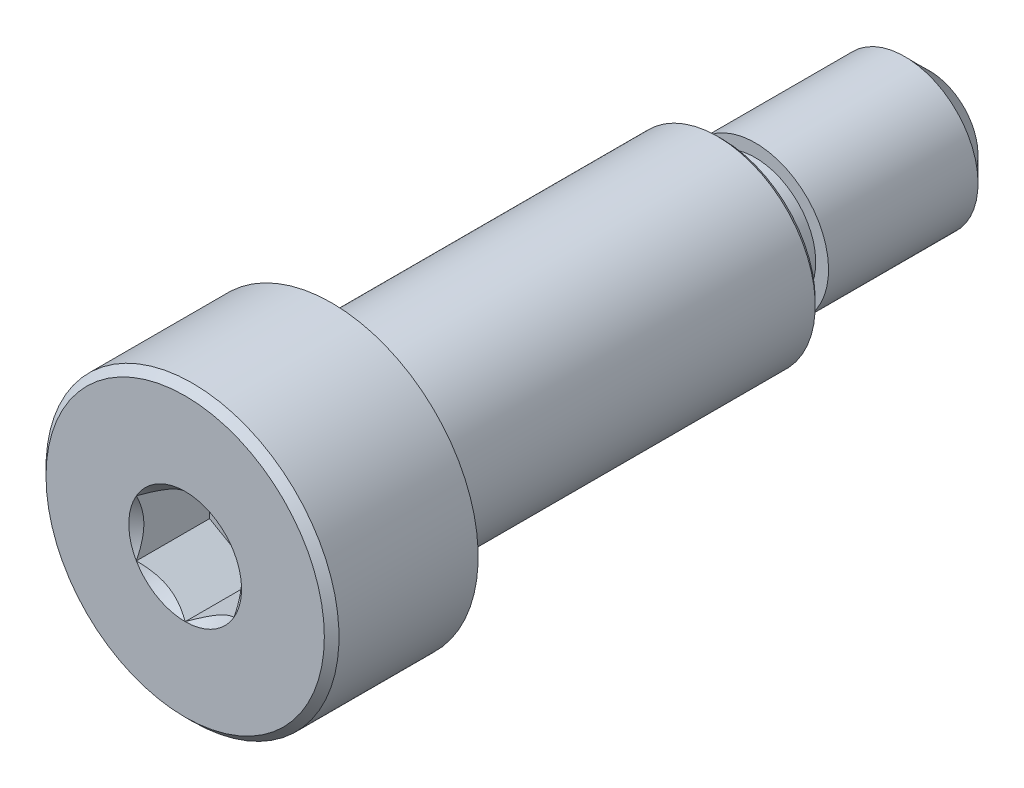
from build123d import *

# Parameters (mm, degrees)
CUT_EXTRUDE1_START = 7.621
CUT_EXTRUDE1_DEPTH = 1.5
CHAMFER1_SIZE      = 0.0975
CHAMFER2_SIZE      = 0.506148016


# Read off the part's stored shape, not the designer's step: Cut-Revolve-Thin1
with BuildPart() as part:
    # Sketch3 → Revolve1 (revolve)
    with BuildSketch(Plane(origin=(0, 0, 0), x_dir=(0, 0, -1), z_dir=(1, 0, 0)), mode=Mode.PRIVATE) as revolve1_sk:
        with BuildLine():
            Line((-7.621, 0), (-7.621, 2.805))
            Line((-7.621, 2.805), (-7.621, 3))
            Line((-7.621, 3), (-4.816, 3))
            Line((-4.816, 3), (-4.621, 3))
            Line((-4.621, 3), (-4.621, 1.797))
            Line((-4.621, 1.797), (-4.494, 1.797))
            Line((-4.494, 1.797), (-4.494, 2))
            Line((-4.494, 2), (3.379, 2))
            Line((3.379, 2), (3.379, 1.36904775))
            ThreePointArc((3.379, 1.36904775), (3.417355026, 1.276450526), (3.50995225, 1.2380955))
            Line((3.50995225, 1.2380955), (4.053864022, 1.2380955))
            Line((4.053864022, 1.2380955), (4.053864022, 1.5))
            Line((4.053864022, 1.5), (7.246, 1.5))
            Line((7.246, 1.5), (7.621, 1.5))
            Line((7.621, 1.5), (7.621, 0))
            Line((7.621, 0), (-7.621, 0))
        make_face()
    revolve(revolve1_sk.sketch.rotate(Axis((0, 0, 7.621), (0, 0, -1)), 180), axis=Axis((0, 0, 7.621), (0, 0, -1)))

    # Cut-Revolve-Thin1 outline → Cut-Revolve-Thin1 (revolve, cut)
    with BuildSketch(Plane.XZ):
        Polygon((1.758927081, 4.495436258), (1.461927081, -3.377563742), (1.5, -3.379), (1.797, 4.494), align=None)
    revolve(axis=Axis((0, 0, 0), (0, 0, 1)), mode=Mode.SUBTRACT)

    # Sketch4 → Cut-Extrude1 (cut)
    with BuildSketch(Plane.XY.offset(CUT_EXTRUDE1_START)):
        Polygon((0, 1.154700538), (-1, 0.577350269), (-1, -0.577350269), (0, -1.154700538), (1, -0.577350269), (1, 0.577350269), align=None)
    extrude(amount=-CUT_EXTRUDE1_DEPTH, mode=Mode.SUBTRACT)

    # Cut-Extrude2 cone 1 section (through the dimple's axis) → Cut-Extrude2 (revolve, cut)
    with BuildSketch(Plane(origin=(0, 0, 7.621), x_dir=(0, -1, 0), z_dir=(1, 0, 0))):
        Polygon((0, 0), (1.154700538, 0), (0, 1.154700538), align=None)
    revolve(axis=Axis((0, 0, 7.621), (0, 0, -1)), mode=Mode.SUBTRACT)

    # Chamfer1
    chamfer1_edges = [part.edges().sort_by_distance(p)[0] for p in [
        (0, 2, -3.379),
    ]]
    chamfer(chamfer1_edges, length=CHAMFER1_SIZE)

    # Chamfer2
    chamfer2_edges = [part.edges().sort_by_distance(p)[0] for p in [
        (0, 1.5, -7.621),
    ]]
    chamfer(chamfer2_edges, length=CHAMFER2_SIZE)

    # Sketch10 → Cut-Revolve2 (revolve, cut)
    with BuildSketch(Plane(origin=(0, 0, 0), x_dir=(0, 0, -1), z_dir=(1, 0, 0)), mode=Mode.PRIVATE) as cut_revolve2_sk:
        Polygon((-7.621, 2.85), (-7.471, 3), (-7.621, 3), align=None)
    revolve(cut_revolve2_sk.sketch.rotate(Axis((0, 0, 7.621), (0, 0, -1)), 180), axis=Axis((0, 0, 7.621), (0, 0, -1)), mode=Mode.SUBTRACT)


solid = part.part
